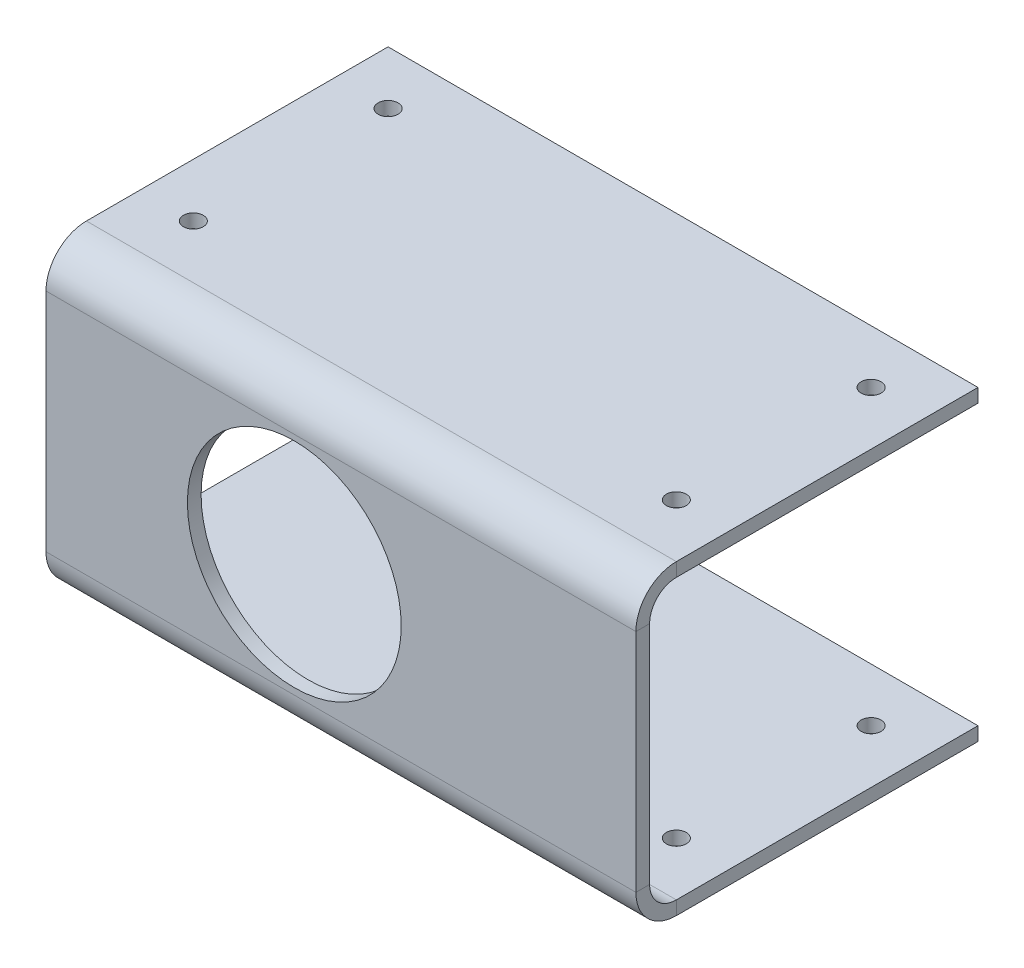
from build123d import *

# Parameters (mm, degrees)
BASE_FLANGE1_DEPTH             = 0.8128
EDGE_FLANGE1_STRIP_W           = 6.4262
EDGE_FLANGE1_STRIP_H           = 0.8128
EDGE_FLANGE1_STRIP_CUT_DEPTH   = 35.042145822
EDGE_FLANGE1_STRIP_2_W         = 6.4262
EDGE_FLANGE1_STRIP_2_H         = 0.8128
EDGE_FLANGE1_STRIP_CUT_2_DEPTH = 35.042145822
EDGE_FLANGE1_DEPTH             = 35.042145822
EDGE_FLANGE1_BEND_DEPTH        = 35.042145822
SKETCH12_R                     = 6.35
CUT_EXTRUDE1_DEPTH             = 32.60643662
F_56_0_0465_DIAMETER_HOLE1_D   = 1.1811


# Sheet-metal steps are written as plain solids
with BuildPart() as part:
    # Sketch1 → Base-Flange1 (new body)
    with BuildSketch(Plane.XY):
        Polygon((-12.622145822, 8.32), (16.07, 8.32), (22.42, 8.32), (22.42, -8.27), (16.07, -8.27), (-12.622145822, -8.27), align=None)
    extrude(amount=BASE_FLANGE1_DEPTH)

    # Edge-Flange1 strip (across the edge) → Edge-Flange1 strip cut (cut)
    with BuildSketch(Plane(origin=(22.42, -8.27, 0), x_dir=(0, 1, 0), z_dir=(-1, 0, 0))):
        with Locations((-1.6256, -0.4064)):
            Rectangle(EDGE_FLANGE1_STRIP_W, EDGE_FLANGE1_STRIP_H)
    extrude(amount=EDGE_FLANGE1_STRIP_CUT_DEPTH, mode=Mode.SUBTRACT)

    # Edge-Flange1 strip 2 (across the edge) → Edge-Flange1 strip cut 2 (cut)
    with BuildSketch(Plane(origin=(-12.622145822, 8.32, 0), x_dir=(0, -1, 0), z_dir=(1, 0, 0))):
        with Locations((-1.6256, -0.4064)):
            Rectangle(EDGE_FLANGE1_STRIP_2_W, EDGE_FLANGE1_STRIP_2_H)
    extrude(amount=EDGE_FLANGE1_STRIP_CUT_2_DEPTH, mode=Mode.SUBTRACT)

    # Edge-Flange1 section (across the edge) → Edge-Flange1 (add)
    with BuildSketch(Plane(origin=(22.42, -8.27, 0), x_dir=(0, 1, 0), z_dir=(-1, 0, 0))):
        with BuildLine():
            Line((-0.8128, 1.5875), (-0.8128, 19.5072))
            Line((-0.8128, 19.5072), (0, 19.5072))
            Line((0, 19.5072), (0, 1.5875))
            ThreePointArc((0, 1.5875), (0.464967985, 0.464967985), (1.5875, 0))
            Line((1.5875, 0), (1.5875, -0.8128))
            ThreePointArc((1.5875, -0.8128), (-0.109768407, -0.109768407), (-0.8128, 1.5875))
        make_face()
    extrude(amount=EDGE_FLANGE1_DEPTH)

    # Edge-Flange1 section 2 (across the edge) → Edge-Flange1 bend (add)
    with BuildSketch(Plane(origin=(-12.622145822, 8.32, 0), x_dir=(0, -1, 0), z_dir=(1, 0, 0))):
        with BuildLine():
            Line((-0.8128, 1.5875), (-0.8128, 19.5072))
            Line((-0.8128, 19.5072), (0, 19.5072))
            Line((0, 19.5072), (0, 1.5875))
            ThreePointArc((0, 1.5875), (0.464967985, 0.464967985), (1.5875, 0))
            Line((1.5875, 0), (1.5875, -0.8128))
            ThreePointArc((1.5875, -0.8128), (-0.109768407, -0.109768407), (-0.8128, 1.5875))
        make_face()
    extrude(amount=EDGE_FLANGE1_BEND_DEPTH)

    # Sketch12 → Cut-Extrude1 (cut, through all)
    with BuildSketch(Plane.XY.offset(0.8128)):
        with Locations((2.127854178, 0.05)):
            Circle(SKETCH12_R)
    extrude(amount=-CUT_EXTRUDE1_DEPTH, mode=Mode.SUBTRACT)

    # #56 (0.0465) Diameter Hole1 (through all)
    with Locations(Plane(origin=(0, 9.1328, 0), x_dir=(1, 0, 0), z_dir=(0, 1, 0))):
        with Locations((19.245, 4.7625), (19.245, 16.3322), (-9.447145822, 16.3322), (-9.447145822, 4.7625)):
            Hole(F_56_0_0465_DIAMETER_HOLE1_D / 2)


solid = part.part
